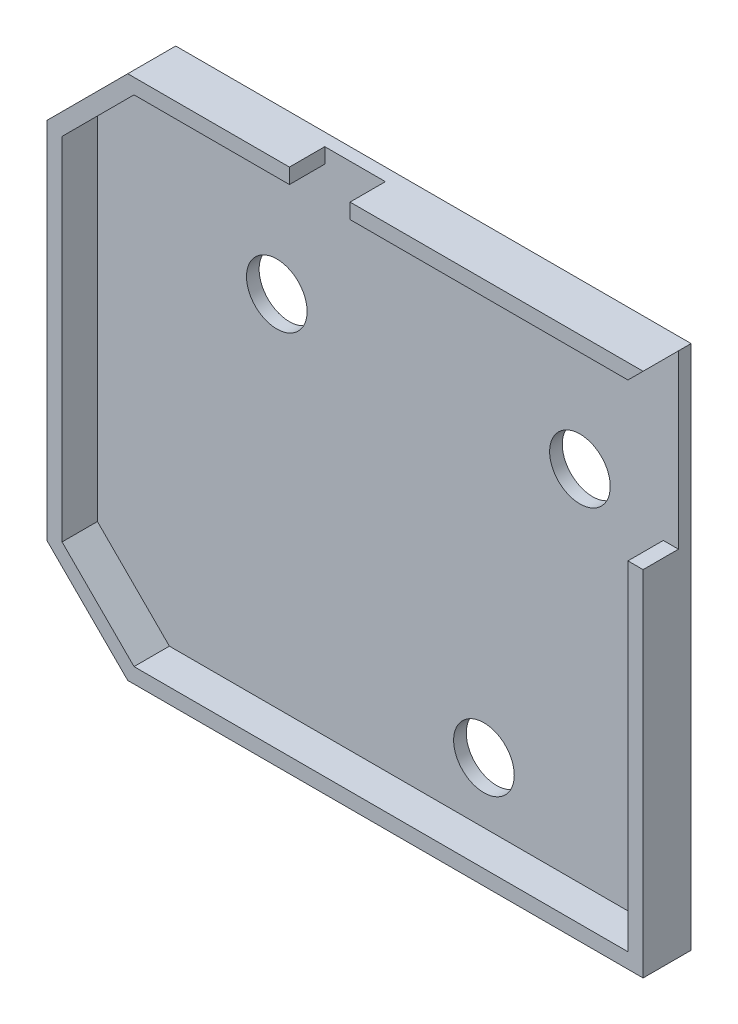
from build123d import *

# Parameters (mm, degrees)
BOSS_EXTRU_1_DEPTH      = 2.5
BOSS_EXTRU_2_DEPTH      = 7
ESQUISSE3_R             = 6
ENL_V_MAT_EXTRU_1_DEPTH = 10


with BuildPart() as part:
    # Esquisse1 → Boss.-Extru.1 (new body)
    with BuildSketch(Plane.XY):
        Polygon((0, -85), (16, -101), (118, -101), (118, 3), (16, 3), (0, -13), align=None)
    extrude(amount=BOSS_EXTRU_1_DEPTH)

    # Esquisse2 → Boss.-Extru.2 (add)
    with BuildSketch(Plane.XY.offset(2.5)):
        Polygon((115, -31), (118, -31), (118, -101), (16, -101), (0, -85), (0, -13), (16, 3), (48, 3), (48, 0), (17.242640687, 0), (3, -14.242640687), (3, -83.757359313), (17.242640687, -98), (115, -98), align=None)
        Polygon((115, 0), (118, 3), (60, 3), (60, 0), align=None)
    extrude(amount=BOSS_EXTRU_2_DEPTH)

    # Esquisse3 → Enlèv. mat.-Extru.1 (cut)
    with BuildSketch(Plane.XY.offset(2.5)):
        with Locations((98.5, -27)):
            Circle(ESQUISSE3_R)
        with Locations((38.5, -27)):
            Circle(ESQUISSE3_R)
        with Locations((79.5, -86)):
            Circle(ESQUISSE3_R)
    extrude(amount=-ENL_V_MAT_EXTRU_1_DEPTH, mode=Mode.SUBTRACT)


solid = part.part
